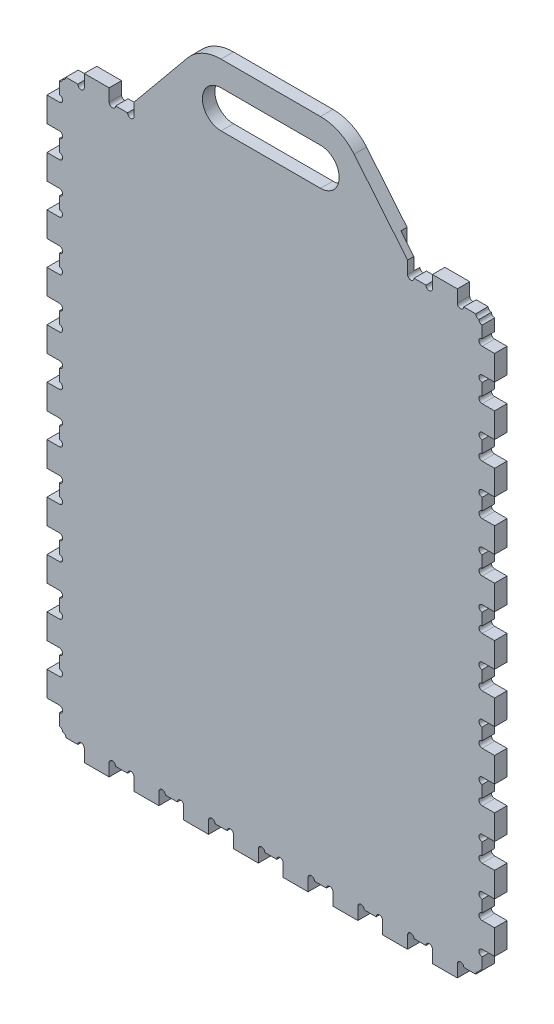
from build123d import *

# Parameters (mm, degrees)
SKETCH1_W               = 457.2
SKETCH1_H               = 609.6
BOSS_EXTRUDE1_DEPTH     = 12.7
CUT_EXTRUDE1_DEPTH      = 382.211607903
LPATTERN1_COUNT         = 9
LPATTERN1_PITCH         = 50.8
SKETCH6_W               = 12.7
SKETCH6_H               = 12.7
CUT_EXTRUDE4_DEPTH      = 382.211607903
CUT_EXTRUDE2_DEPTH      = 382.211607903
LPATTERN2_COUNT         = 12
LPATTERN2_PITCH         = 50.8
MIRROR7_COPY_1_SKETCH_W = 12.7
MIRROR7_COPY_1_SKETCH_H = 12.7
MIRROR7_COPY_1_DEPTH    = 382.211607903
MIRROR1_COPY_1_DEPTH    = 382.211607903
MIRROR1_COPY_2_DEPTH    = 382.211607903
MIRROR1_COPY_3_DEPTH    = 382.211607903
MIRROR1_COPY_4_DEPTH    = 382.211607903
MIRROR1_COPY_5_DEPTH    = 382.211607903
MIRROR1_COPY_6_DEPTH    = 382.211607903
MIRROR1_COPY_7_DEPTH    = 382.211607903
MIRROR1_COPY_8_DEPTH    = 382.211607903
MIRROR1_COPY_9_DEPTH    = 382.211607903
MIRROR1_COPY_10_DEPTH   = 382.211607903
MIRROR1_COPY_11_DEPTH   = 382.211607903
MIRROR1_COPY_12_DEPTH   = 382.211607903
MIRROR2_COPY_1_DEPTH    = 382.211607903
MIRROR2_COPY_2_DEPTH    = 382.211607903
MIRROR2_COPY_3_DEPTH    = 382.211607903
MIRROR2_COPY_4_DEPTH    = 382.211607903
MIRROR2_COPY_5_DEPTH    = 382.211607903
MIRROR2_COPY_6_DEPTH    = 382.211607903
MIRROR2_COPY_7_DEPTH    = 382.211607903
MIRROR2_COPY_8_DEPTH    = 382.211607903
MIRROR2_COPY_9_DEPTH    = 382.211607903
BOSS_EXTRUDE3_DEPTH     = 12.7
SKETCH10_R              = 3.302
CUT_EXTRUDE6_DEPTH      = 12.7
LPATTERN3_COUNT         = 5
LPATTERN3_PITCH         = 50.8
CUT_EXTRUDE7_DEPTH      = 450.954744947
LPATTERN4_COUNT         = 10
LPATTERN4_PITCH         = 50.8
SKETCH12_W              = 245.24962915
SKETCH12_H              = 28.56753922
BOSS_EXTRUDE4_DEPTH     = 12.7
CUT_EXTRUDE8_DEPTH      = 6.35
SKETCH14_W              = 39.762732248
SKETCH14_H              = 507.471870309
BOSS_EXTRUDE5_DEPTH     = 12.7


with BuildPart() as part:
    # Sketch1 → Boss-Extrude1 (new body)
    with BuildSketch(Plane.XY):
        Rectangle(SKETCH1_W, SKETCH1_H)
    extrude(amount=BOSS_EXTRUDE1_DEPTH)

    # Sketch2 → Cut-Extrude1 (cut, through all)
    with BuildSketch(Plane.XY.offset(12.7)):
        with BuildLine():
            Line((-190.5, 304.8), (-215.9, 304.8))
            Line((-215.9, 304.8), (-215.9, 292.1))
            ThreePointArc((-215.9, 292.1), (-212.598, 288.798), (-209.296, 292.1))
            Line((-209.296, 292.1), (-197.104, 292.1))
            ThreePointArc((-197.104, 292.1), (-193.802, 288.798), (-190.5, 292.1))
            Line((-190.5, 292.1), (-190.5, 304.8))
        make_face()
    cut_extrude1 = extrude(amount=-CUT_EXTRUDE1_DEPTH, mode=Mode.SUBTRACT)

    # LPattern1: Cut-Extrude1 ×9
    with Locations(*[(i * LPATTERN1_PITCH, 0, 0) for i in range(1, LPATTERN1_COUNT)]):
        add(cut_extrude1, mode=Mode.SUBTRACT)

    # Sketch6 → Cut-Extrude4 (cut, through all)
    with BuildSketch(Plane.XY.offset(12.7)):
        with Locations((-222.25, 298.45)):
            Rectangle(SKETCH6_W, SKETCH6_H)
    cut_extrude4 = extrude(amount=-CUT_EXTRUDE4_DEPTH, mode=Mode.SUBTRACT)

    # Sketch3 → Cut-Extrude2 (cut, through all)
    with BuildSketch(Plane.XY.offset(12.7)):
        with BuildLine():
            Line((-215.9, 292.1), (-228.6, 292.1))
            Line((-228.6, 292.1), (-228.6, 266.7))
            Line((-228.6, 266.7), (-215.9, 266.7))
            ThreePointArc((-215.9, 266.7), (-212.598, 270.002), (-215.9, 273.304))
            Line((-215.9, 273.304), (-215.9, 285.496))
            ThreePointArc((-215.9, 285.496), (-212.598, 288.798), (-215.9, 292.1))
        make_face()
    cut_extrude2 = extrude(amount=-CUT_EXTRUDE2_DEPTH, mode=Mode.SUBTRACT)

    # LPattern2: Cut-Extrude2 ×12
    with Locations(*[(0, -i * LPATTERN2_PITCH, 0) for i in range(1, LPATTERN2_COUNT)]):
        add(cut_extrude2, mode=Mode.SUBTRACT)

    # Mirror6: Cut-Extrude4 across plane
    add(cut_extrude4.mirror(Plane(origin=(0, 0, 0), x_dir=(0, 0, 1), z_dir=(1, 0, 0))), mode=Mode.SUBTRACT)

    # Mirror7: Cut-Extrude4 across plane
    add(cut_extrude4.mirror(Plane.ZX), mode=Mode.SUBTRACT)

    # Mirror7 copy 1 sketch → Mirror7 copy 1 (cut, through all)
    with BuildSketch(Plane(origin=(0, 0, 12.7), x_dir=(-1, 0, 0), z_dir=(0, 0, 1))):
        with Locations((-222.25, 298.45)):
            Rectangle(MIRROR7_COPY_1_SKETCH_W, MIRROR7_COPY_1_SKETCH_H)
    extrude(amount=-MIRROR7_COPY_1_DEPTH, mode=Mode.SUBTRACT)

    # Mirror1 copy 1 sketch → Mirror1 copy 1 (cut, through all)
    with BuildSketch(Plane(origin=(0, -50.8, 12.7), x_dir=(-1, 0, 0), z_dir=(0, 0, 1))):
        with BuildLine():
            Line((-215.9, -292.1), (-228.6, -292.1))
            Line((-228.6, -292.1), (-228.6, -266.7))
            Line((-228.6, -266.7), (-215.9, -266.7))
            ThreePointArc((-215.9, -266.7), (-212.598, -270.002), (-215.9, -273.304))
            Line((-215.9, -273.304), (-215.9, -285.496))
            ThreePointArc((-215.9, -285.496), (-212.598, -288.798), (-215.9, -292.1))
        make_face()
    extrude(amount=-MIRROR1_COPY_1_DEPTH, mode=Mode.SUBTRACT)

    # Mirror1 copy 2 sketch → Mirror1 copy 2 (cut, through all)
    with BuildSketch(Plane(origin=(0, -101.6, 12.7), x_dir=(-1, 0, 0), z_dir=(0, 0, 1))):
        with BuildLine():
            Line((-215.9, -292.1), (-228.6, -292.1))
            Line((-228.6, -292.1), (-228.6, -266.7))
            Line((-228.6, -266.7), (-215.9, -266.7))
            ThreePointArc((-215.9, -266.7), (-212.598, -270.002), (-215.9, -273.304))
            Line((-215.9, -273.304), (-215.9, -285.496))
            ThreePointArc((-215.9, -285.496), (-212.598, -288.798), (-215.9, -292.1))
        make_face()
    extrude(amount=-MIRROR1_COPY_2_DEPTH, mode=Mode.SUBTRACT)

    # Mirror1 copy 3 sketch → Mirror1 copy 3 (cut, through all)
    with BuildSketch(Plane(origin=(0, -152.4, 12.7), x_dir=(-1, 0, 0), z_dir=(0, 0, 1))):
        with BuildLine():
            Line((-215.9, -292.1), (-228.6, -292.1))
            Line((-228.6, -292.1), (-228.6, -266.7))
            Line((-228.6, -266.7), (-215.9, -266.7))
            ThreePointArc((-215.9, -266.7), (-212.598, -270.002), (-215.9, -273.304))
            Line((-215.9, -273.304), (-215.9, -285.496))
            ThreePointArc((-215.9, -285.496), (-212.598, -288.798), (-215.9, -292.1))
        make_face()
    extrude(amount=-MIRROR1_COPY_3_DEPTH, mode=Mode.SUBTRACT)

    # Mirror1 copy 4 sketch → Mirror1 copy 4 (cut, through all)
    with BuildSketch(Plane(origin=(0, -203.2, 12.7), x_dir=(-1, 0, 0), z_dir=(0, 0, 1))):
        with BuildLine():
            Line((-215.9, -292.1), (-228.6, -292.1))
            Line((-228.6, -292.1), (-228.6, -266.7))
            Line((-228.6, -266.7), (-215.9, -266.7))
            ThreePointArc((-215.9, -266.7), (-212.598, -270.002), (-215.9, -273.304))
            Line((-215.9, -273.304), (-215.9, -285.496))
            ThreePointArc((-215.9, -285.496), (-212.598, -288.798), (-215.9, -292.1))
        make_face()
    extrude(amount=-MIRROR1_COPY_4_DEPTH, mode=Mode.SUBTRACT)

    # Mirror1 copy 5 sketch → Mirror1 copy 5 (cut, through all)
    with BuildSketch(Plane(origin=(0, -254, 12.7), x_dir=(-1, 0, 0), z_dir=(0, 0, 1))):
        with BuildLine():
            Line((-215.9, -292.1), (-228.6, -292.1))
            Line((-228.6, -292.1), (-228.6, -266.7))
            Line((-228.6, -266.7), (-215.9, -266.7))
            ThreePointArc((-215.9, -266.7), (-212.598, -270.002), (-215.9, -273.304))
            Line((-215.9, -273.304), (-215.9, -285.496))
            ThreePointArc((-215.9, -285.496), (-212.598, -288.798), (-215.9, -292.1))
        make_face()
    extrude(amount=-MIRROR1_COPY_5_DEPTH, mode=Mode.SUBTRACT)

    # Mirror1 copy 6 sketch → Mirror1 copy 6 (cut, through all)
    with BuildSketch(Plane(origin=(0, -304.8, 12.7), x_dir=(-1, 0, 0), z_dir=(0, 0, 1))):
        with BuildLine():
            Line((-215.9, -292.1), (-228.6, -292.1))
            Line((-228.6, -292.1), (-228.6, -266.7))
            Line((-228.6, -266.7), (-215.9, -266.7))
            ThreePointArc((-215.9, -266.7), (-212.598, -270.002), (-215.9, -273.304))
            Line((-215.9, -273.304), (-215.9, -285.496))
            ThreePointArc((-215.9, -285.496), (-212.598, -288.798), (-215.9, -292.1))
        make_face()
    extrude(amount=-MIRROR1_COPY_6_DEPTH, mode=Mode.SUBTRACT)

    # Mirror1 copy 7 sketch → Mirror1 copy 7 (cut, through all)
    with BuildSketch(Plane(origin=(0, -355.6, 12.7), x_dir=(-1, 0, 0), z_dir=(0, 0, 1))):
        with BuildLine():
            Line((-215.9, -292.1), (-228.6, -292.1))
            Line((-228.6, -292.1), (-228.6, -266.7))
            Line((-228.6, -266.7), (-215.9, -266.7))
            ThreePointArc((-215.9, -266.7), (-212.598, -270.002), (-215.9, -273.304))
            Line((-215.9, -273.304), (-215.9, -285.496))
            ThreePointArc((-215.9, -285.496), (-212.598, -288.798), (-215.9, -292.1))
        make_face()
    extrude(amount=-MIRROR1_COPY_7_DEPTH, mode=Mode.SUBTRACT)

    # Mirror1 copy 8 sketch → Mirror1 copy 8 (cut, through all)
    with BuildSketch(Plane(origin=(0, -406.4, 12.7), x_dir=(-1, 0, 0), z_dir=(0, 0, 1))):
        with BuildLine():
            Line((-215.9, -292.1), (-228.6, -292.1))
            Line((-228.6, -292.1), (-228.6, -266.7))
            Line((-228.6, -266.7), (-215.9, -266.7))
            ThreePointArc((-215.9, -266.7), (-212.598, -270.002), (-215.9, -273.304))
            Line((-215.9, -273.304), (-215.9, -285.496))
            ThreePointArc((-215.9, -285.496), (-212.598, -288.798), (-215.9, -292.1))
        make_face()
    extrude(amount=-MIRROR1_COPY_8_DEPTH, mode=Mode.SUBTRACT)

    # Mirror1 copy 9 sketch → Mirror1 copy 9 (cut, through all)
    with BuildSketch(Plane(origin=(0, -457.2, 12.7), x_dir=(-1, 0, 0), z_dir=(0, 0, 1))):
        with BuildLine():
            Line((-215.9, -292.1), (-228.6, -292.1))
            Line((-228.6, -292.1), (-228.6, -266.7))
            Line((-228.6, -266.7), (-215.9, -266.7))
            ThreePointArc((-215.9, -266.7), (-212.598, -270.002), (-215.9, -273.304))
            Line((-215.9, -273.304), (-215.9, -285.496))
            ThreePointArc((-215.9, -285.496), (-212.598, -288.798), (-215.9, -292.1))
        make_face()
    extrude(amount=-MIRROR1_COPY_9_DEPTH, mode=Mode.SUBTRACT)

    # Mirror1 copy 10 sketch → Mirror1 copy 10 (cut, through all)
    with BuildSketch(Plane(origin=(0, -508, 12.7), x_dir=(-1, 0, 0), z_dir=(0, 0, 1))):
        with BuildLine():
            Line((-215.9, -292.1), (-228.6, -292.1))
            Line((-228.6, -292.1), (-228.6, -266.7))
            Line((-228.6, -266.7), (-215.9, -266.7))
            ThreePointArc((-215.9, -266.7), (-212.598, -270.002), (-215.9, -273.304))
            Line((-215.9, -273.304), (-215.9, -285.496))
            ThreePointArc((-215.9, -285.496), (-212.598, -288.798), (-215.9, -292.1))
        make_face()
    extrude(amount=-MIRROR1_COPY_10_DEPTH, mode=Mode.SUBTRACT)

    # Mirror1 copy 11 sketch → Mirror1 copy 11 (cut, through all)
    with BuildSketch(Plane(origin=(0, -558.8, 12.7), x_dir=(-1, 0, 0), z_dir=(0, 0, 1))):
        with BuildLine():
            Line((-215.9, -292.1), (-228.6, -292.1))
            Line((-228.6, -292.1), (-228.6, -266.7))
            Line((-228.6, -266.7), (-215.9, -266.7))
            ThreePointArc((-215.9, -266.7), (-212.598, -270.002), (-215.9, -273.304))
            Line((-215.9, -273.304), (-215.9, -285.496))
            ThreePointArc((-215.9, -285.496), (-212.598, -288.798), (-215.9, -292.1))
        make_face()
    extrude(amount=-MIRROR1_COPY_11_DEPTH, mode=Mode.SUBTRACT)

    # Mirror1 copy 12 sketch → Mirror1 copy 12 (cut, through all)
    with BuildSketch(Plane(origin=(0, 0, 12.7), x_dir=(-1, 0, 0), z_dir=(0, 0, 1))):
        with BuildLine():
            Line((-215.9, -292.1), (-228.6, -292.1))
            Line((-228.6, -292.1), (-228.6, -266.7))
            Line((-228.6, -266.7), (-215.9, -266.7))
            ThreePointArc((-215.9, -266.7), (-212.598, -270.002), (-215.9, -273.304))
            Line((-215.9, -273.304), (-215.9, -285.496))
            ThreePointArc((-215.9, -285.496), (-212.598, -288.798), (-215.9, -292.1))
        make_face()
    extrude(amount=-MIRROR1_COPY_12_DEPTH, mode=Mode.SUBTRACT)

    # Mirror2 copy 1 sketch → Mirror2 copy 1 (cut, through all)
    with BuildSketch(Plane(origin=(50.8, 0, 12.7), x_dir=(1, 0, 0), z_dir=(0, 0, 1))):
        with BuildLine():
            Line((-190.5, -304.8), (-215.9, -304.8))
            Line((-215.9, -304.8), (-215.9, -292.1))
            ThreePointArc((-215.9, -292.1), (-212.598, -288.798), (-209.296, -292.1))
            Line((-209.296, -292.1), (-197.104, -292.1))
            ThreePointArc((-197.104, -292.1), (-193.802, -288.798), (-190.5, -292.1))
            Line((-190.5, -292.1), (-190.5, -304.8))
        make_face()
    extrude(amount=-MIRROR2_COPY_1_DEPTH, mode=Mode.SUBTRACT)

    # Mirror2 copy 2 sketch → Mirror2 copy 2 (cut, through all)
    with BuildSketch(Plane(origin=(101.6, 0, 12.7), x_dir=(1, 0, 0), z_dir=(0, 0, 1))):
        with BuildLine():
            Line((-190.5, -304.8), (-215.9, -304.8))
            Line((-215.9, -304.8), (-215.9, -292.1))
            ThreePointArc((-215.9, -292.1), (-212.598, -288.798), (-209.296, -292.1))
            Line((-209.296, -292.1), (-197.104, -292.1))
            ThreePointArc((-197.104, -292.1), (-193.802, -288.798), (-190.5, -292.1))
            Line((-190.5, -292.1), (-190.5, -304.8))
        make_face()
    extrude(amount=-MIRROR2_COPY_2_DEPTH, mode=Mode.SUBTRACT)

    # Mirror2 copy 3 sketch → Mirror2 copy 3 (cut, through all)
    with BuildSketch(Plane(origin=(152.4, 0, 12.7), x_dir=(1, 0, 0), z_dir=(0, 0, 1))):
        with BuildLine():
            Line((-190.5, -304.8), (-215.9, -304.8))
            Line((-215.9, -304.8), (-215.9, -292.1))
            ThreePointArc((-215.9, -292.1), (-212.598, -288.798), (-209.296, -292.1))
            Line((-209.296, -292.1), (-197.104, -292.1))
            ThreePointArc((-197.104, -292.1), (-193.802, -288.798), (-190.5, -292.1))
            Line((-190.5, -292.1), (-190.5, -304.8))
        make_face()
    extrude(amount=-MIRROR2_COPY_3_DEPTH, mode=Mode.SUBTRACT)

    # Mirror2 copy 4 sketch → Mirror2 copy 4 (cut, through all)
    with BuildSketch(Plane(origin=(203.2, 0, 12.7), x_dir=(1, 0, 0), z_dir=(0, 0, 1))):
        with BuildLine():
            Line((-190.5, -304.8), (-215.9, -304.8))
            Line((-215.9, -304.8), (-215.9, -292.1))
            ThreePointArc((-215.9, -292.1), (-212.598, -288.798), (-209.296, -292.1))
            Line((-209.296, -292.1), (-197.104, -292.1))
            ThreePointArc((-197.104, -292.1), (-193.802, -288.798), (-190.5, -292.1))
            Line((-190.5, -292.1), (-190.5, -304.8))
        make_face()
    extrude(amount=-MIRROR2_COPY_4_DEPTH, mode=Mode.SUBTRACT)

    # Mirror2 copy 5 sketch → Mirror2 copy 5 (cut, through all)
    with BuildSketch(Plane(origin=(254, 0, 12.7), x_dir=(1, 0, 0), z_dir=(0, 0, 1))):
        with BuildLine():
            Line((-190.5, -304.8), (-215.9, -304.8))
            Line((-215.9, -304.8), (-215.9, -292.1))
            ThreePointArc((-215.9, -292.1), (-212.598, -288.798), (-209.296, -292.1))
            Line((-209.296, -292.1), (-197.104, -292.1))
            ThreePointArc((-197.104, -292.1), (-193.802, -288.798), (-190.5, -292.1))
            Line((-190.5, -292.1), (-190.5, -304.8))
        make_face()
    extrude(amount=-MIRROR2_COPY_5_DEPTH, mode=Mode.SUBTRACT)

    # Mirror2 copy 6 sketch → Mirror2 copy 6 (cut, through all)
    with BuildSketch(Plane(origin=(304.8, 0, 12.7), x_dir=(1, 0, 0), z_dir=(0, 0, 1))):
        with BuildLine():
            Line((-190.5, -304.8), (-215.9, -304.8))
            Line((-215.9, -304.8), (-215.9, -292.1))
            ThreePointArc((-215.9, -292.1), (-212.598, -288.798), (-209.296, -292.1))
            Line((-209.296, -292.1), (-197.104, -292.1))
            ThreePointArc((-197.104, -292.1), (-193.802, -288.798), (-190.5, -292.1))
            Line((-190.5, -292.1), (-190.5, -304.8))
        make_face()
    extrude(amount=-MIRROR2_COPY_6_DEPTH, mode=Mode.SUBTRACT)

    # Mirror2 copy 7 sketch → Mirror2 copy 7 (cut, through all)
    with BuildSketch(Plane(origin=(355.6, 0, 12.7), x_dir=(1, 0, 0), z_dir=(0, 0, 1))):
        with BuildLine():
            Line((-190.5, -304.8), (-215.9, -304.8))
            Line((-215.9, -304.8), (-215.9, -292.1))
            ThreePointArc((-215.9, -292.1), (-212.598, -288.798), (-209.296, -292.1))
            Line((-209.296, -292.1), (-197.104, -292.1))
            ThreePointArc((-197.104, -292.1), (-193.802, -288.798), (-190.5, -292.1))
            Line((-190.5, -292.1), (-190.5, -304.8))
        make_face()
    extrude(amount=-MIRROR2_COPY_7_DEPTH, mode=Mode.SUBTRACT)

    # Mirror2 copy 8 sketch → Mirror2 copy 8 (cut, through all)
    with BuildSketch(Plane(origin=(406.4, 0, 12.7), x_dir=(1, 0, 0), z_dir=(0, 0, 1))):
        with BuildLine():
            Line((-190.5, -304.8), (-215.9, -304.8))
            Line((-215.9, -304.8), (-215.9, -292.1))
            ThreePointArc((-215.9, -292.1), (-212.598, -288.798), (-209.296, -292.1))
            Line((-209.296, -292.1), (-197.104, -292.1))
            ThreePointArc((-197.104, -292.1), (-193.802, -288.798), (-190.5, -292.1))
            Line((-190.5, -292.1), (-190.5, -304.8))
        make_face()
    extrude(amount=-MIRROR2_COPY_8_DEPTH, mode=Mode.SUBTRACT)

    # Mirror2 copy 9 sketch → Mirror2 copy 9 (cut, through all)
    with BuildSketch(Plane.XY.offset(12.7)):
        with BuildLine():
            Line((-190.5, -304.8), (-215.9, -304.8))
            Line((-215.9, -304.8), (-215.9, -292.1))
            ThreePointArc((-215.9, -292.1), (-212.598, -288.798), (-209.296, -292.1))
            Line((-209.296, -292.1), (-197.104, -292.1))
            ThreePointArc((-197.104, -292.1), (-193.802, -288.798), (-190.5, -292.1))
            Line((-190.5, -292.1), (-190.5, -304.8))
        make_face()
    extrude(amount=-MIRROR2_COPY_9_DEPTH, mode=Mode.SUBTRACT)

    # Sketch9 → Boss-Extrude3 (add)
    with BuildSketch(Plane(origin=(0, 0, 0), x_dir=(-1, 0, 0), z_dir=(0, 0, -1))):
        with BuildLine():
            Line((-85.127373824, 371.138872257), (-139.7, 304.8))
            Line((-139.7, 304.8), (27.904749401, 304.8))
            Line((27.904749401, 304.8), (139.7, 304.8))
            Line((139.7, 304.8), (85.127373824, 371.138872257))
            ThreePointArc((85.127373824, 371.138872257), (69.781367551, 383.093409732), (50.8, 387.35))
            Line((50.8, 387.35), (-50.8, 387.35))
            ThreePointArc((-50.8, 387.35), (-69.781367551, 383.093409732), (-85.127373824, 371.138872257))
        make_face()
        with BuildLine():
            ThreePointArc((-50.8, 323.85), (-69.85, 342.9), (-50.8, 361.95))
            Line((-50.8, 361.95), (50.8, 361.95))
            ThreePointArc((50.8, 361.95), (69.85, 342.9), (50.8, 323.85))
            Line((50.8, 323.85), (-50.8, 323.85))
        make_face(mode=Mode.SUBTRACT)
    extrude(amount=-BOSS_EXTRUDE3_DEPTH)

    # Sketch10 → Cut-Extrude6 (cut)
    with BuildSketch(Plane(origin=(0, 0, 0), x_dir=(-1, 0, 0), z_dir=(0, 0, -1))):
        with Locations((-110.998, 304.8)):
            Circle(SKETCH10_R)
        with Locations((-92.202, 304.8)):
            Circle(SKETCH10_R)
    cut_extrude6 = extrude(amount=-CUT_EXTRUDE6_DEPTH, mode=Mode.SUBTRACT)

    # LPattern3: Cut-Extrude6 ×5
    with Locations(*[(-i * LPATTERN3_PITCH, 0, 0) for i in range(1, LPATTERN3_COUNT)]):
        add(cut_extrude6, mode=Mode.SUBTRACT)

    # Sketch11 → Cut-Extrude7 (cut, through all)
    with BuildSketch(Plane(origin=(0, 0, 0), x_dir=(-1, 0, 0), z_dir=(0, 0, -1))):
        with BuildLine():
            Line((-101.6, 241.3), (-114.3, 241.3))
            ThreePointArc((-114.3, 241.3), (-117.602, 237.998), (-114.3, 234.696))
            Line((-114.3, 234.696), (-114.3, 222.504))
            ThreePointArc((-114.3, 222.504), (-117.602, 219.202), (-114.3, 215.9))
            Line((-114.3, 215.9), (-101.6, 215.9))
            ThreePointArc((-101.6, 215.9), (-98.298, 219.202), (-101.6, 222.504))
            Line((-101.6, 222.504), (-101.6, 234.696))
            ThreePointArc((-101.6, 234.696), (-98.298, 237.998), (-101.6, 241.3))
        make_face()
    cut_extrude7 = extrude(amount=-CUT_EXTRUDE7_DEPTH, mode=Mode.SUBTRACT)

    # LPattern4: Cut-Extrude7 ×10
    with Locations(*[(0, -i * LPATTERN4_PITCH, 0) for i in range(1, LPATTERN4_COUNT)]):
        add(cut_extrude7, mode=Mode.SUBTRACT)

    # Sketch12 → Boss-Extrude4 (add)
    with BuildSketch(Plane(origin=(0, 0, 0), x_dir=(-1, 0, 0), z_dir=(0, 0, -1))):
        with Locations((1.841307269, 297.669157719)):
            Rectangle(SKETCH12_W, SKETCH12_H)
    extrude(amount=-BOSS_EXTRUDE4_DEPTH)

    # Sketch13 → Cut-Extrude8 (cut)
    with BuildSketch(Plane(origin=(0, 0, 0), x_dir=(-1, 0, 0), z_dir=(0, 0, -1))):
        with BuildLine():
            Line((-126.492, 320.855738676), (-139.7, 304.8))
            Line((-139.7, 304.8), (-139.7, -266.7))
            ThreePointArc((-139.7, -266.7), (-136.398, -270.002), (-133.096, -266.7))
            ThreePointArc((-133.096, -266.7), (-129.794, -270.002), (-126.492, -266.7))
            Line((-126.492, -266.7), (-126.492, 320.855738676))
        make_face()
    extrude(amount=-CUT_EXTRUDE8_DEPTH, mode=Mode.SUBTRACT)

    # Sketch14 → Boss-Extrude5 (add)
    with BuildSketch(Plane(origin=(0, 0, 0), x_dir=(-1, 0, 0), z_dir=(0, 0, -1))):
        with Locations((-99.903864772, -1.22142009)):
            Rectangle(SKETCH14_W, SKETCH14_H)
    extrude(amount=-BOSS_EXTRUDE5_DEPTH)


solid = part.part
